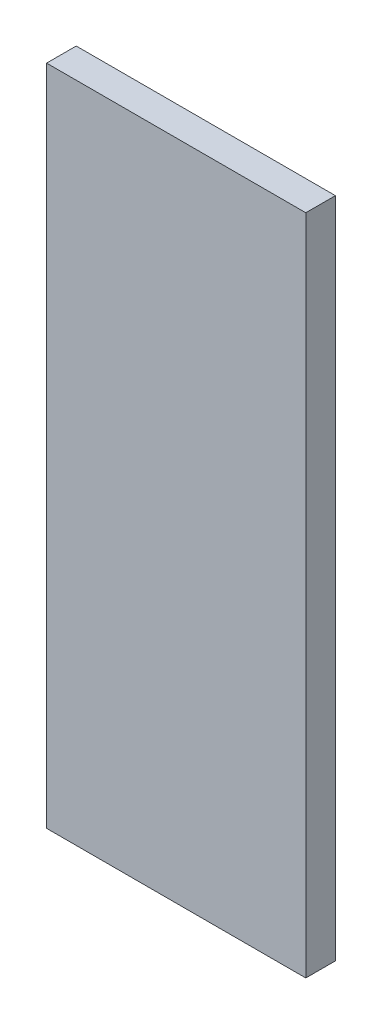
from build123d import *

# Parameters (mm, degrees)
SKETCH1_W           = 166.6875
SKETCH1_H           = 426.212
BOSS_EXTRUDE1_DEPTH = 19.05


with BuildPart() as part:
    # Sketch1 → Boss-Extrude1 (new body)
    with BuildSketch(Plane.XY):
        with Locations((67.335084573, -183.875362757)):
            Rectangle(SKETCH1_W, SKETCH1_H)
    extrude(amount=BOSS_EXTRUDE1_DEPTH)


solid = part.part
